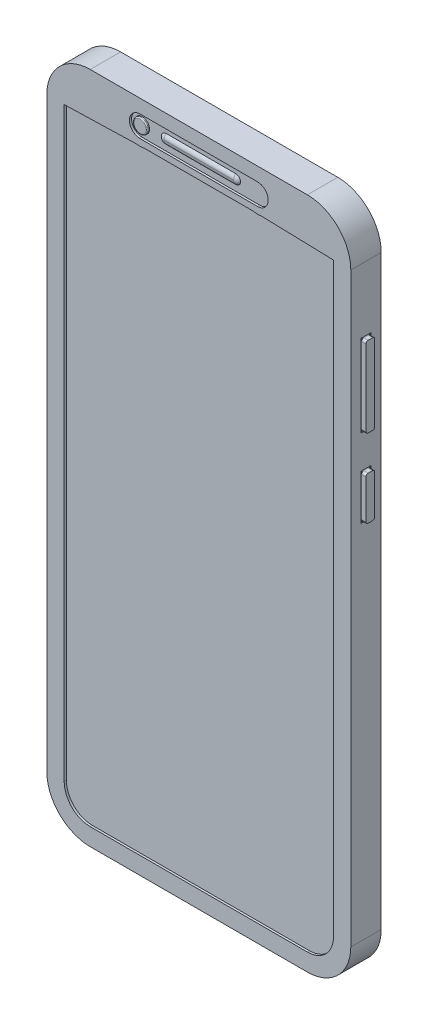
from build123d import *

# Parameters (mm, degrees)
SKETCH1_W           = 70
SKETCH1_H           = 155
BOSS_EXTRUDE1_DEPTH = 7
FILLET1_R           = 10
SKETCH3_W           = 2.4
SKETCH3_H           = 18.9
SKETCH3_W_2         = 2
SKETCH3_H_2         = 18.5
CUT_EXTRUDE1_DEPTH  = 2
SKETCH3_2_W         = 2
SKETCH3_2_H         = 18.5
BOSS_EXTRUDE2_DEPTH = 1
FILLET2_R           = 0.5
SKETCH4_W           = 2.4
SKETCH4_H           = 10.4
SKETCH4_W_2         = 2
SKETCH4_H_2         = 10
CUT_EXTRUDE2_DEPTH  = 1
SKETCH4_2_W         = 2
SKETCH4_2_H         = 10
BOSS_EXTRUDE3_DEPTH = 1
FILLET3_R           = 0.5
SKETCH6_R           = 2
SKETCH6_R_2         = 1
CUT_EXTRUDE3_DEPTH  = 11
BOSS_EXTRUDE4_DEPTH = 10
SKETCH8_R           = 1.678551751
CUT_EXTRUDE4_DEPTH  = 0.5
FILLET4_R           = 1.3
FILLET5_R           = 0.25


with BuildPart() as part:
    # Sketch1 → Boss-Extrude1 (new body)
    with BuildSketch(Plane.XY):
        Rectangle(SKETCH1_W, SKETCH1_H)
    extrude(amount=BOSS_EXTRUDE1_DEPTH)

    # Fillet1
    fillet1_edges = [part.edges().sort_by_distance(p)[0] for p in [
        (35, -77.5, 3.5),
        (-35, -77.5, 3.5),
        (-35, 77.5, 3.5),
        (35, 77.5, 3.5),
    ]]
    fillet(fillet1_edges, radius=FILLET1_R)

    # Sketch3 → Cut-Extrude1 (cut)
    with BuildSketch(Plane(origin=(35, 0, 0), x_dir=(0, 0, -1), z_dir=(1, 0, 0))):
        with Locations((-3.5, 43.25)):
            Rectangle(SKETCH3_W, SKETCH3_H)
        with Locations((-3.5, 43.25)):
            Rectangle(SKETCH3_W_2, SKETCH3_H_2, mode=Mode.SUBTRACT)
    extrude(amount=-CUT_EXTRUDE1_DEPTH, mode=Mode.SUBTRACT)

    # Sketch4 → Cut-Extrude2 (cut)
    with BuildSketch(Plane(origin=(35, 0, 0), x_dir=(0, 0, -1), z_dir=(1, 0, 0))):
        with Locations((-3.5, 21)):
            Rectangle(SKETCH4_W, SKETCH4_H)
        with Locations((-3.5, 21)):
            Rectangle(SKETCH4_W_2, SKETCH4_H_2, mode=Mode.SUBTRACT)
    extrude(amount=-CUT_EXTRUDE2_DEPTH, mode=Mode.SUBTRACT)

    # Sketch6 → Cut-Extrude3 (cut)
    with BuildSketch(Plane.XZ.offset(77.5)):
        with Locations(Location((-25, 3.5, 0), (0, 0, 270))):
            Circle(SKETCH6_R)
        with Locations(Location((22, 3.5, 0), (0, 0, 270))):
            Circle(SKETCH6_R_2)
        with Locations(Location((19, 3.5, 0), (0, 0, 270))):
            Circle(SKETCH6_R_2)
        with Locations(Location((16, 3.5, 0), (0, 0, 270))):
            Circle(SKETCH6_R_2)
        with Locations(Location((13, 3.5, 0), (0, 0, 270))):
            Circle(SKETCH6_R_2)
        with Locations(Location((25, 3.5, 0), (0, 0, 270))):
            Circle(SKETCH6_R_2)
        with BuildLine():
            Line((-3.8, 5.2), (3.8, 5.2))
            ThreePointArc((3.8, 5.2), (5.5, 3.5), (3.8, 1.8))
            Line((3.8, 1.8), (-3.8, 1.8))
            ThreePointArc((-3.8, 1.8), (-5.5, 3.5), (-3.8, 5.2))
        make_face()
    extrude(amount=-CUT_EXTRUDE3_DEPTH, mode=Mode.SUBTRACT)

    # Sketch7 → Boss-Extrude4 (add)
    with BuildSketch(Plane.XZ.offset(66.5)):
        with BuildLine():
            Line((-3.8, 2.3), (3.8, 2.3))
            ThreePointArc((3.8, 2.3), (5, 3.5), (3.8, 4.7))
            Line((3.8, 4.7), (-3.8, 4.7))
            ThreePointArc((-3.8, 4.7), (-5, 3.5), (-3.8, 2.3))
        make_face()
        with BuildLine():
            Line((-3.8, 2.8), (3.8, 2.8))
            ThreePointArc((3.8, 2.8), (4.5, 3.5), (3.8, 4.2))
            Line((3.8, 4.2), (-3.8, 4.2))
            ThreePointArc((-3.8, 4.2), (-4.5, 3.5), (-3.8, 2.8))
        make_face(mode=Mode.SUBTRACT)
    extrude(amount=BOSS_EXTRUDE4_DEPTH)

    # Sketch8 → Cut-Extrude4 (cut)
    # profile 1 of 2: a face of its own
    with BuildSketch(Plane.XY.offset(7)):
        with BuildLine():
            Line((-14.242131715, 67.97091146), (-31, 67.5))
            Line((-31, 67.5), (-31, -67.5))
            ThreePointArc((-31, -67.5), (-29.242640687, -71.742640687), (-25, -73.5))
            Line((-25, -73.5), (25, -73.5))
            ThreePointArc((25, -73.5), (29.242640687, -71.742640687), (31, -67.5))
            Line((31, -67.5), (31, 67.5))
            Line((31, 67.5), (14.242131715, 67.97091146))
            ThreePointArc((14.242131715, 67.97091146), (13.408727505, 67.906964941), (12.580229547, 68.017612435))
            Line((12.580229547, 68.017612435), (-12.580229547, 68.017612435))
            ThreePointArc((-12.580229547, 68.017612435), (-13.408727505, 67.906964941), (-14.242131715, 67.97091146))
        make_face()
    # profile 2 of 2: a face of its own
    with BuildSketch(Plane.XY.offset(7)):
        with BuildLine():
            Line((-13.521086818, 69.44976806), (13.521086818, 69.44976806))
            ThreePointArc((13.521086818, 69.44976806), (15.976705311, 71.905386553), (13.521086818, 74.361005047))
            Line((13.521086818, 74.361005047), (-13.521086818, 74.361005047))
            ThreePointArc((-13.521086818, 74.361005047), (-15.976705311, 71.905386553), (-13.521086818, 69.44976806))
        make_face()
        with Locations((-13.521086818, 71.905386553)):
            Circle(SKETCH8_R, mode=Mode.SUBTRACT)
        with BuildLine():
            ThreePointArc((8.03571554, 70.832453492), (9.108648601, 71.905386553), (8.03571554, 72.978319614))
            Line((8.03571554, 72.978319614), (-8.03571554, 72.978319614))
            ThreePointArc((-8.03571554, 72.978319614), (-9.108648601, 71.905386553), (-8.03571554, 70.832453492))
            Line((-8.03571554, 70.832453492), (8.03571554, 70.832453492))
        make_face(mode=Mode.SUBTRACT)
    extrude(amount=-CUT_EXTRUDE4_DEPTH, mode=Mode.SUBTRACT)

    # Fillet4
    # the kernel refuses this fillet: 1.3 mm, written as the material it takes off along each edge
    with BuildSketch(Plane(origin=(8.03571554, 72.978319614, 7), x_dir=(0, 0, -1), z_dir=(-1, 0, 0)), Plane(origin=(-8.03571554, 70.832453492, 7), x_dir=(0, 0, -1), z_dir=(1, 0, 0))) as fillet4_piece_1:
        with BuildLine():
            CenterArc((1.3, 1.024695077), FILLET4_R, 180, 52.020127555)
            Line((0, 1.024695077), (-0.026, 1.024695077))
            Line((-0.026, 1.024695077), (-0.026, 0))
            Line((-0.026, 0), (0, -0.026))
            ThreePointArc((0, -0.026), (0.25, -0.026), (0.484, -0.020493902))
            Line((0.484, -0.020493902), (0.5, 0))
        make_face()
    extrude(amount=16.07143108, mode=Mode.SUBTRACT)
    with BuildSketch(Plane(origin=(-8.03571554, 71.905386553, 7), x_dir=(0, 1, 0), z_dir=(1, 0, 0))) as fillet4_piece_2:
        with BuildLine():
            CenterArc((0.048237984, -1.3), FILLET4_R, 37.979872445, 52.020127555)
            Line((0.048237984, 0), (0.048237984, 0.026))
            Line((0.048237984, 0.026), (1.072933061, 0.026))
            Line((1.072933061, 0.026), (1.098933061, 0))
            ThreePointArc((1.098933061, 0), (1.098933061, -0.25), (1.093426962, -0.484))
            Line((1.093426962, -0.484), (1.072933061, -0.5))
        make_face()
    revolve(axis=Axis((-8.03571554, 71.905386553, 7), (0, 0, 1)), revolution_arc=180, mode=Mode.SUBTRACT)
    with BuildSketch(Plane(origin=(8.03571554, 71.905386553, 7), x_dir=(0, -1, 0), z_dir=(-1, 0, 0))) as fillet4_piece_3:
        with BuildLine():
            CenterArc((0.048237984, -1.3), FILLET4_R, 37.979872445, 52.020127555)
            Line((0.048237984, 0), (0.048237984, 0.026))
            Line((0.048237984, 0.026), (1.072933061, 0.026))
            Line((1.072933061, 0.026), (1.098933061, 0))
            ThreePointArc((1.098933061, 0), (1.098933061, -0.25), (1.093426962, -0.484))
            Line((1.093426962, -0.484), (1.072933061, -0.5))
        make_face()
    revolve(axis=Axis((8.03571554, 71.905386553, 7), (0, 0, 1)), revolution_arc=180, mode=Mode.SUBTRACT)

    # Fillet5
    fillet5_edges = [part.edges().sort_by_distance(p)[0] for p in [
        (-15.199638568, 71.905386553, 7),
    ]]
    fillet(fillet5_edges, radius=FILLET5_R)


with BuildPart() as body_2:
    # Sketch3<2> → Boss-Extrude2 (new body)
    with BuildSketch(Plane(origin=(35, 0, 0), x_dir=(0, 0, -1), z_dir=(1, 0, 0))):
        with Locations((-3.5, 43.25)):
            Rectangle(SKETCH3_2_W, SKETCH3_2_H)
    extrude(amount=BOSS_EXTRUDE2_DEPTH)

    # Fillet2
    fillet2_edges = [body_2.edges().sort_by_distance(p)[0] for p in [
        (35.5, 34, 2.5),
        (35.5, 34, 4.5),
        (35.5, 52.5, 4.5),
        (35.5, 52.5, 2.5),
    ]]
    fillet(fillet2_edges, radius=FILLET2_R)


with BuildPart() as body_3:
    # Sketch4<2> → Boss-Extrude3 (new body)
    with BuildSketch(Plane(origin=(35, 0, 0), x_dir=(0, 0, -1), z_dir=(1, 0, 0))):
        with Locations((-3.5, 21)):
            Rectangle(SKETCH4_2_W, SKETCH4_2_H)
    extrude(amount=BOSS_EXTRUDE3_DEPTH)

    # Fillet3
    fillet3_edges = [body_3.edges().sort_by_distance(p)[0] for p in [
        (35.5, 16, 4.5),
        (35.5, 26, 4.5),
        (35.5, 26, 2.5),
        (35.5, 16, 2.5),
    ]]
    fillet(fillet3_edges, radius=FILLET3_R)


solid = Compound([part.part, body_2.part, body_3.part])
